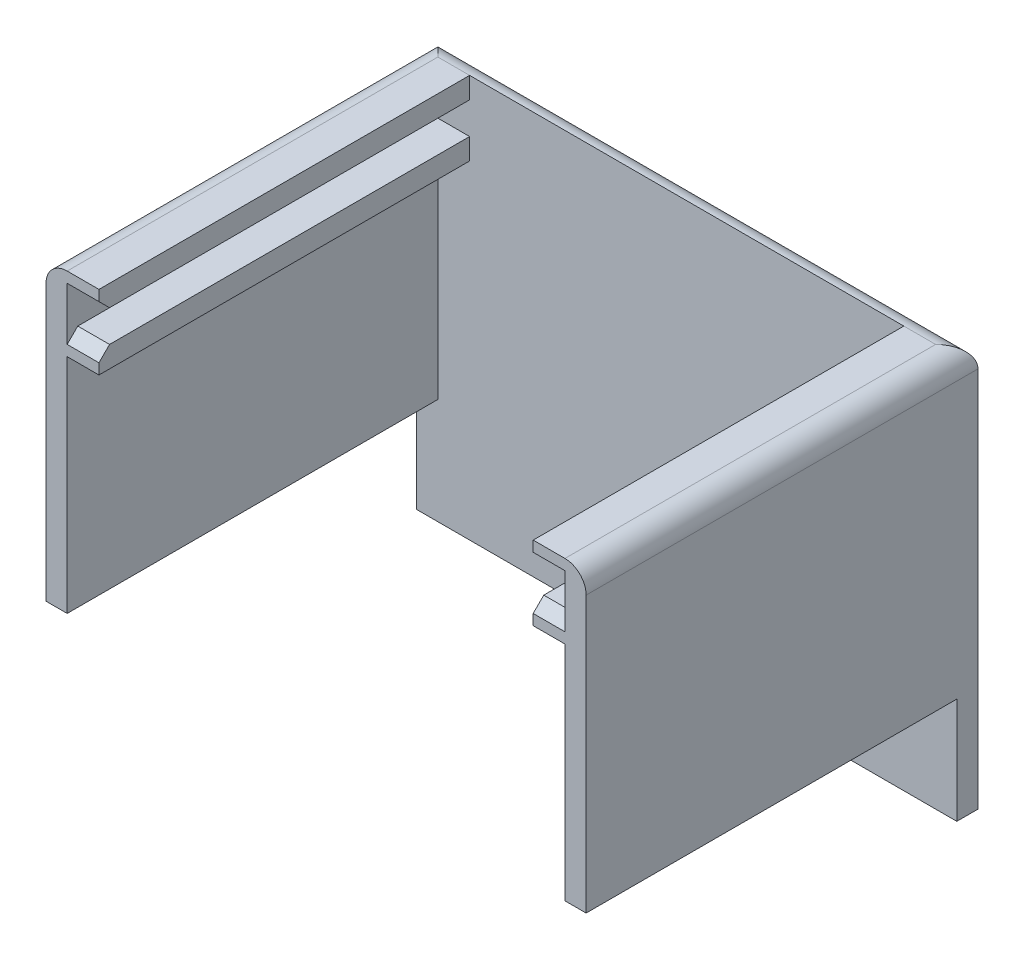
from build123d import *

# Parameters (mm, degrees)
CROQUIS1_W              = 51
CROQUIS1_H              = 39
CROQUIS1_W_2            = 47
CROQUIS1_H_2            = 35
SALIENTE_EXTRUIR1_DEPTH = 36
CROQUIS2_W              = 51
CROQUIS2_H              = 39
SALIENTE_EXTRUIR2_DEPTH = 2
CROQUIS3_W              = 5
CROQUIS3_H              = 39
SALIENTE_EXTRUIR3_DEPTH = 2
CROQUIS4_W              = 51
CROQUIS4_H              = 2
CORTAR_EXTRUIR1_DEPTH   = 50.744346412
CROQUIS5_W              = 3
CROQUIS5_H              = 2
SALIENTE_EXTRUIR4_DEPTH = 35
REDONDEO1_R             = 2
CHAFL_N1_SIZE           = 1
CROQUIS6_W              = 35
CROQUIS6_H              = 10
CORTAR_EXTRUIR2_DEPTH   = 66.40068807


with BuildPart() as part:
    # Croquis1 → Saliente-Extruir1 (new body)
    with BuildSketch(Plane(origin=(0, 0, 0), x_dir=(1, 0, 0), z_dir=(0, 1, 0))):
        Rectangle(CROQUIS1_W, CROQUIS1_H)
        Rectangle(CROQUIS1_W_2, CROQUIS1_H_2, mode=Mode.SUBTRACT)
    extrude(amount=SALIENTE_EXTRUIR1_DEPTH)

    # Croquis2 → Saliente-Extruir2 (add)
    with BuildSketch(Plane.XZ):
        Rectangle(CROQUIS2_W, CROQUIS2_H)
    extrude(amount=SALIENTE_EXTRUIR2_DEPTH)

    # Croquis3 → Saliente-Extruir3 (add)
    with BuildSketch(Plane(origin=(0, 36, 0), x_dir=(1, 0, 0), z_dir=(0, 1, 0))):
        with Locations((-23, 0)):
            Rectangle(CROQUIS3_W, CROQUIS3_H)
        with Locations((23, 0)):
            Rectangle(CROQUIS3_W, CROQUIS3_H)
    extrude(amount=-SALIENTE_EXTRUIR3_DEPTH)

    # Croquis4 → Cortar-Extruir1 (cut, through all)
    with BuildSketch(Plane(origin=(0, 36, 0), x_dir=(1, 0, 0), z_dir=(0, 1, 0))):
        with Locations((0, -18.5)):
            Rectangle(CROQUIS4_W, CROQUIS4_H)
    extrude(amount=-CORTAR_EXTRUIR1_DEPTH, mode=Mode.SUBTRACT)

    # Croquis5 → Saliente-Extruir4 (add)
    with BuildSketch(Plane.XY.offset(17.5)):
        with Locations((-22, 30)):
            Rectangle(CROQUIS5_W, CROQUIS5_H)
        with Locations((22, 30)):
            Rectangle(CROQUIS5_W, CROQUIS5_H)
    extrude(amount=-SALIENTE_EXTRUIR4_DEPTH)

    # Redondeo1
    redondeo1_edges = [part.edges().sort_by_distance(p)[0] for p in [
        (-25.5, 36, -1),
        (0, 36, -19.5),
        (25.5, 36, -1),
    ]]
    fillet(redondeo1_edges, radius=REDONDEO1_R - 0.0001)  # a hair under: the kernel refuses the full size

    # Chaflán1
    chafl_n1_edges = [part.edges().sort_by_distance(p)[0] for p in [
        (-22, 31, 17.5),
        (22, 31, 17.5),
        (-22, 34, 17.5),
        (22, 34, 17.5),
    ]]
    chamfer(chafl_n1_edges, length=CHAFL_N1_SIZE)

    # Croquis6 → Cortar-Extruir2 (cut, through all)
    with BuildSketch(Plane(origin=(25.5, 0, 0), x_dir=(0, 0, -1), z_dir=(1, 0, 0))):
        with Locations((0, 3)):
            Rectangle(CROQUIS6_W, CROQUIS6_H)
    extrude(amount=-CORTAR_EXTRUIR2_DEPTH, mode=Mode.SUBTRACT)


solid = part.part
